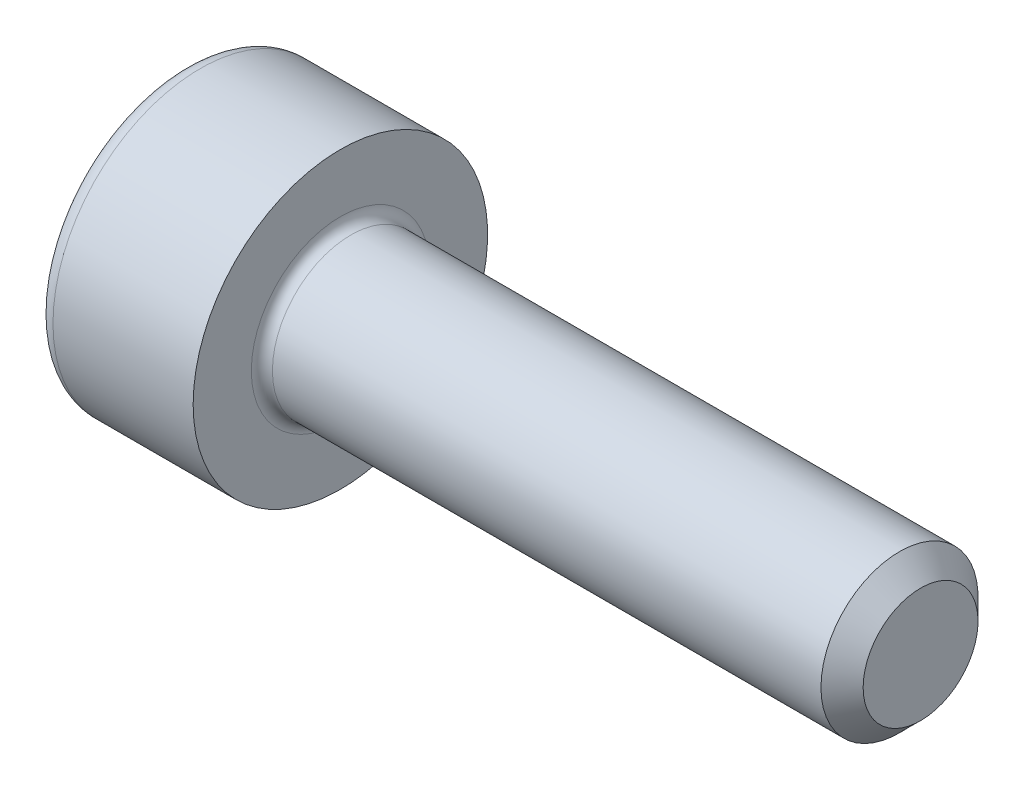
from build123d import *

# Parameters (mm, degrees)
FILLET1_R      = 0.1
FILLET2_R      = 0.16
CHAMFER1_SIZE  = 0.2
EXTRUDE1_DEPTH = 0.7


with BuildPart() as part:
    # Sketch1 → Revolve1 (revolve)
    with BuildSketch(Plane.XY):
        Polygon((0, 1.395688245), (0, 0), (6.988734128, 0), (6.988734128, 0.744367064), (1.488734128, 0.744367064), (1.488734128, 1.395688245), align=None)
    revolve(axis=Axis((0, 0, 0), (1, 0, 0)))

    # Fillet1
    fillet1_edges = [part.edges().sort_by_distance(p)[0] for p in [
        (1.488734128, -0.744367064, 0),
    ]]
    fillet(fillet1_edges, radius=FILLET1_R)

    # Fillet2
    fillet2_edges = [part.edges().sort_by_distance(p)[0] for p in [
        (0, -1.395688245, 0),
    ]]
    fillet(fillet2_edges, radius=FILLET2_R)

    # Chamfer1
    chamfer1_edges = [part.edges().sort_by_distance(p)[0] for p in [
        (6.988734128, -0.744367064, 0),
    ]]
    chamfer(chamfer1_edges, length=CHAMFER1_SIZE)

    # Sketch2 → Extrude1 (cut)
    with BuildSketch(Plane.ZY):
        Polygon((0, 0.877572409), (-0.76, 0.438786205), (-0.76, -0.438786205), (0, -0.877572409), (0.76, -0.438786205), (0.76, 0.438786205), align=None)
    extrude(amount=-EXTRUDE1_DEPTH, mode=Mode.SUBTRACT)


solid = part.part
